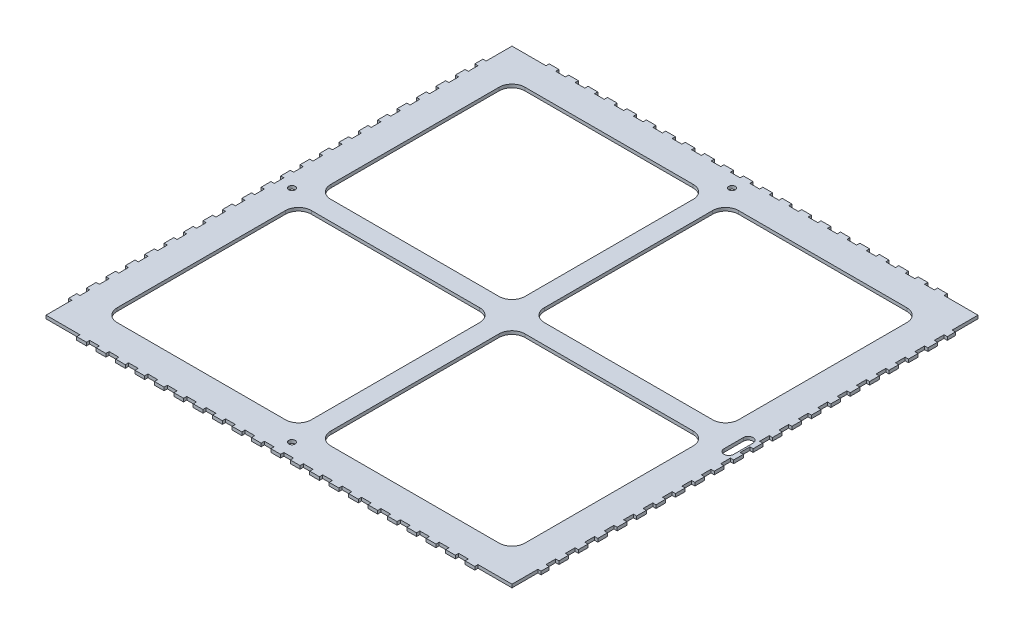
from build123d import *

# Parameters (mm, degrees)
SKETCH1_W                = 228.6
SKETCH1_H                = 228.6
BOSS_EXTRUDE1_DEPTH      = 0.79375
SKETCH2_W                = 4.7625
SKETCH2_H                = 1.5875
BOSS_EXTRUDE2_DEPTH      = 1.5875
LPATTERN1_COUNT          = 11
LPATTERN1_PITCH          = 9.525
LPATTERN1_COL_COUNT      = 11
LPATTERN1_COL_PITCH      = 9.525
MIRROR1_COPY_1_SKETCH_W  = 4.7625
MIRROR1_COPY_1_SKETCH_H  = 1.5875
MIRROR1_COPY_1_DEPTH     = 1.5875
MIRROR1_COPY_2_SKETCH_W  = 4.7625
MIRROR1_COPY_2_SKETCH_H  = 1.5875
MIRROR1_COPY_2_DEPTH     = 1.5875
MIRROR1_COPY_3_SKETCH_W  = 4.7625
MIRROR1_COPY_3_SKETCH_H  = 1.5875
MIRROR1_COPY_3_DEPTH     = 1.5875
MIRROR1_COPY_4_SKETCH_W  = 4.7625
MIRROR1_COPY_4_SKETCH_H  = 1.5875
MIRROR1_COPY_4_DEPTH     = 1.5875
MIRROR1_COPY_5_SKETCH_W  = 4.7625
MIRROR1_COPY_5_SKETCH_H  = 1.5875
MIRROR1_COPY_5_DEPTH     = 1.5875
MIRROR1_COPY_6_SKETCH_W  = 4.7625
MIRROR1_COPY_6_SKETCH_H  = 1.5875
MIRROR1_COPY_6_DEPTH     = 1.5875
MIRROR1_COPY_7_SKETCH_W  = 4.7625
MIRROR1_COPY_7_SKETCH_H  = 1.5875
MIRROR1_COPY_7_DEPTH     = 1.5875
MIRROR1_COPY_8_SKETCH_W  = 4.7625
MIRROR1_COPY_8_SKETCH_H  = 1.5875
MIRROR1_COPY_8_DEPTH     = 1.5875
MIRROR1_COPY_9_SKETCH_W  = 4.7625
MIRROR1_COPY_9_SKETCH_H  = 1.5875
MIRROR1_COPY_9_DEPTH     = 1.5875
MIRROR1_COPY_10_SKETCH_W = 4.7625
MIRROR1_COPY_10_SKETCH_H = 1.5875
MIRROR1_COPY_10_DEPTH    = 1.5875
MIRROR1_COPY_11_SKETCH_W = 4.7625
MIRROR1_COPY_11_SKETCH_H = 1.5875
MIRROR1_COPY_11_DEPTH    = 1.5875
MIRROR1_COPY_12_SKETCH_W = 4.7625
MIRROR1_COPY_12_SKETCH_H = 1.5875
MIRROR1_COPY_12_DEPTH    = 1.5875
MIRROR1_COPY_13_SKETCH_W = 4.7625
MIRROR1_COPY_13_SKETCH_H = 1.5875
MIRROR1_COPY_13_DEPTH    = 1.5875
MIRROR1_COPY_14_SKETCH_W = 4.7625
MIRROR1_COPY_14_SKETCH_H = 1.5875
MIRROR1_COPY_14_DEPTH    = 1.5875
MIRROR1_COPY_15_SKETCH_W = 4.7625
MIRROR1_COPY_15_SKETCH_H = 1.5875
MIRROR1_COPY_15_DEPTH    = 1.5875
MIRROR1_COPY_16_SKETCH_W = 4.7625
MIRROR1_COPY_16_SKETCH_H = 1.5875
MIRROR1_COPY_16_DEPTH    = 1.5875
MIRROR1_COPY_17_SKETCH_W = 4.7625
MIRROR1_COPY_17_SKETCH_H = 1.5875
MIRROR1_COPY_17_DEPTH    = 1.5875
MIRROR1_COPY_18_SKETCH_W = 4.7625
MIRROR1_COPY_18_SKETCH_H = 1.5875
MIRROR1_COPY_18_DEPTH    = 1.5875
MIRROR1_COPY_19_SKETCH_W = 4.7625
MIRROR1_COPY_19_SKETCH_H = 1.5875
MIRROR1_COPY_19_DEPTH    = 1.5875
MIRROR1_COPY_20_SKETCH_W = 4.7625
MIRROR1_COPY_20_SKETCH_H = 1.5875
MIRROR1_COPY_20_DEPTH    = 1.5875
SKETCH3_W                = 1.5875
SKETCH3_H                = 4.7625
BOSS_EXTRUDE3_DEPTH      = 1.5875
LPATTERN2_COUNT          = 6
LPATTERN2_PITCH          = 19.05
LPATTERN2_COL_COUNT      = 6
LPATTERN2_COL_PITCH      = 19.05
SKETCH5_W                = 1.5875
SKETCH5_H                = 0.79375
CUT_EXTRUDE1_DEPTH       = 164.897362605
MIRROR2_START            = 114.3
MIRROR2_OUTLINE_W        = 1.5875
MIRROR2_OUTLINE_H        = 4.7625
MIRROR2_OUTLINE_H_2      = 3.96875
MIRROR2_DEPTH            = 1.5875
SKETCH6_R                = 1.5875
CUT_EXTRUDE2_DEPTH       = 164.897362605
CUT_EXTRUDE3_DEPTH       = 164.897362605
SKETCH8_W                = 95.25
SKETCH8_H                = 95.25
CUT_EXTRUDE4_DEPTH       = 164.897362605
FILLET1_R                = 6.35


# Read off the part's stored shape, not the designer's step: Mirror2
with BuildPart() as part:
    # Sketch1 → Boss-Extrude1 (new, symmetric)
    with BuildSketch(Plane(origin=(0, 0, 0), x_dir=(1, 0, 0), z_dir=(0, 1, 0))):
        Rectangle(SKETCH1_W, SKETCH1_H)
    extrude(amount=BOSS_EXTRUDE1_DEPTH, both=True)

    # Sketch2 → Boss-Extrude2 (add)
    with BuildSketch(Plane(origin=(0, 0.79375, 0), x_dir=(1, 0, 0), z_dir=(0, 1, 0))):
        with Locations((0, 115.09375)):
            Rectangle(SKETCH2_W, SKETCH2_H)
    boss_extrude2 = extrude(amount=-BOSS_EXTRUDE2_DEPTH)

    # LPattern1: Boss-Extrude2 ×11
    with Locations(*[(i * LPATTERN1_PITCH, 0, 0) for i in range(1, LPATTERN1_COUNT)]):
        add(boss_extrude2)

    # LPattern1 col: Boss-Extrude2 ×11
    with Locations(*[(-i * LPATTERN1_COL_PITCH, 0, 0) for i in range(1, LPATTERN1_COL_COUNT)]):
        add(boss_extrude2)

    # Mirror1: Boss-Extrude2 across plane
    add(boss_extrude2.mirror(Plane.XY))

    # Mirror1 copy 1 sketch → Mirror1 copy 1 (add)
    with BuildSketch(Plane(origin=(9.525, 0.79375, 0), x_dir=(1, 0, 0), z_dir=(0, 1, 0))):
        with Locations((0, -115.09375)):
            Rectangle(MIRROR1_COPY_1_SKETCH_W, MIRROR1_COPY_1_SKETCH_H)
    extrude(amount=-MIRROR1_COPY_1_DEPTH)

    # Mirror1 copy 2 sketch → Mirror1 copy 2 (add)
    with BuildSketch(Plane(origin=(19.05, 0.79375, 0), x_dir=(1, 0, 0), z_dir=(0, 1, 0))):
        with Locations((0, -115.09375)):
            Rectangle(MIRROR1_COPY_2_SKETCH_W, MIRROR1_COPY_2_SKETCH_H)
    extrude(amount=-MIRROR1_COPY_2_DEPTH)

    # Mirror1 copy 3 sketch → Mirror1 copy 3 (add)
    with BuildSketch(Plane(origin=(28.575, 0.79375, 0), x_dir=(1, 0, 0), z_dir=(0, 1, 0))):
        with Locations((0, -115.09375)):
            Rectangle(MIRROR1_COPY_3_SKETCH_W, MIRROR1_COPY_3_SKETCH_H)
    extrude(amount=-MIRROR1_COPY_3_DEPTH)

    # Mirror1 copy 4 sketch → Mirror1 copy 4 (add)
    with BuildSketch(Plane(origin=(38.1, 0.79375, 0), x_dir=(1, 0, 0), z_dir=(0, 1, 0))):
        with Locations((0, -115.09375)):
            Rectangle(MIRROR1_COPY_4_SKETCH_W, MIRROR1_COPY_4_SKETCH_H)
    extrude(amount=-MIRROR1_COPY_4_DEPTH)

    # Mirror1 copy 5 sketch → Mirror1 copy 5 (add)
    with BuildSketch(Plane(origin=(47.625, 0.79375, 0), x_dir=(1, 0, 0), z_dir=(0, 1, 0))):
        with Locations((0, -115.09375)):
            Rectangle(MIRROR1_COPY_5_SKETCH_W, MIRROR1_COPY_5_SKETCH_H)
    extrude(amount=-MIRROR1_COPY_5_DEPTH)

    # Mirror1 copy 6 sketch → Mirror1 copy 6 (add)
    with BuildSketch(Plane(origin=(57.15, 0.79375, 0), x_dir=(1, 0, 0), z_dir=(0, 1, 0))):
        with Locations((0, -115.09375)):
            Rectangle(MIRROR1_COPY_6_SKETCH_W, MIRROR1_COPY_6_SKETCH_H)
    extrude(amount=-MIRROR1_COPY_6_DEPTH)

    # Mirror1 copy 7 sketch → Mirror1 copy 7 (add)
    with BuildSketch(Plane(origin=(66.675, 0.79375, 0), x_dir=(1, 0, 0), z_dir=(0, 1, 0))):
        with Locations((0, -115.09375)):
            Rectangle(MIRROR1_COPY_7_SKETCH_W, MIRROR1_COPY_7_SKETCH_H)
    extrude(amount=-MIRROR1_COPY_7_DEPTH)

    # Mirror1 copy 8 sketch → Mirror1 copy 8 (add)
    with BuildSketch(Plane(origin=(76.2, 0.79375, 0), x_dir=(1, 0, 0), z_dir=(0, 1, 0))):
        with Locations((0, -115.09375)):
            Rectangle(MIRROR1_COPY_8_SKETCH_W, MIRROR1_COPY_8_SKETCH_H)
    extrude(amount=-MIRROR1_COPY_8_DEPTH)

    # Mirror1 copy 9 sketch → Mirror1 copy 9 (add)
    with BuildSketch(Plane(origin=(85.725, 0.79375, 0), x_dir=(1, 0, 0), z_dir=(0, 1, 0))):
        with Locations((0, -115.09375)):
            Rectangle(MIRROR1_COPY_9_SKETCH_W, MIRROR1_COPY_9_SKETCH_H)
    extrude(amount=-MIRROR1_COPY_9_DEPTH)

    # Mirror1 copy 10 sketch → Mirror1 copy 10 (add)
    with BuildSketch(Plane(origin=(95.25, 0.79375, 0), x_dir=(1, 0, 0), z_dir=(0, 1, 0))):
        with Locations((0, -115.09375)):
            Rectangle(MIRROR1_COPY_10_SKETCH_W, MIRROR1_COPY_10_SKETCH_H)
    extrude(amount=-MIRROR1_COPY_10_DEPTH)

    # Mirror1 copy 11 sketch → Mirror1 copy 11 (add)
    with BuildSketch(Plane(origin=(-9.525, 0.79375, 0), x_dir=(1, 0, 0), z_dir=(0, 1, 0))):
        with Locations((0, -115.09375)):
            Rectangle(MIRROR1_COPY_11_SKETCH_W, MIRROR1_COPY_11_SKETCH_H)
    extrude(amount=-MIRROR1_COPY_11_DEPTH)

    # Mirror1 copy 12 sketch → Mirror1 copy 12 (add)
    with BuildSketch(Plane(origin=(-19.05, 0.79375, 0), x_dir=(1, 0, 0), z_dir=(0, 1, 0))):
        with Locations((0, -115.09375)):
            Rectangle(MIRROR1_COPY_12_SKETCH_W, MIRROR1_COPY_12_SKETCH_H)
    extrude(amount=-MIRROR1_COPY_12_DEPTH)

    # Mirror1 copy 13 sketch → Mirror1 copy 13 (add)
    with BuildSketch(Plane(origin=(-28.575, 0.79375, 0), x_dir=(1, 0, 0), z_dir=(0, 1, 0))):
        with Locations((0, -115.09375)):
            Rectangle(MIRROR1_COPY_13_SKETCH_W, MIRROR1_COPY_13_SKETCH_H)
    extrude(amount=-MIRROR1_COPY_13_DEPTH)

    # Mirror1 copy 14 sketch → Mirror1 copy 14 (add)
    with BuildSketch(Plane(origin=(-38.1, 0.79375, 0), x_dir=(1, 0, 0), z_dir=(0, 1, 0))):
        with Locations((0, -115.09375)):
            Rectangle(MIRROR1_COPY_14_SKETCH_W, MIRROR1_COPY_14_SKETCH_H)
    extrude(amount=-MIRROR1_COPY_14_DEPTH)

    # Mirror1 copy 15 sketch → Mirror1 copy 15 (add)
    with BuildSketch(Plane(origin=(-47.625, 0.79375, 0), x_dir=(1, 0, 0), z_dir=(0, 1, 0))):
        with Locations((0, -115.09375)):
            Rectangle(MIRROR1_COPY_15_SKETCH_W, MIRROR1_COPY_15_SKETCH_H)
    extrude(amount=-MIRROR1_COPY_15_DEPTH)

    # Mirror1 copy 16 sketch → Mirror1 copy 16 (add)
    with BuildSketch(Plane(origin=(-57.15, 0.79375, 0), x_dir=(1, 0, 0), z_dir=(0, 1, 0))):
        with Locations((0, -115.09375)):
            Rectangle(MIRROR1_COPY_16_SKETCH_W, MIRROR1_COPY_16_SKETCH_H)
    extrude(amount=-MIRROR1_COPY_16_DEPTH)

    # Mirror1 copy 17 sketch → Mirror1 copy 17 (add)
    with BuildSketch(Plane(origin=(-66.675, 0.79375, 0), x_dir=(1, 0, 0), z_dir=(0, 1, 0))):
        with Locations((0, -115.09375)):
            Rectangle(MIRROR1_COPY_17_SKETCH_W, MIRROR1_COPY_17_SKETCH_H)
    extrude(amount=-MIRROR1_COPY_17_DEPTH)

    # Mirror1 copy 18 sketch → Mirror1 copy 18 (add)
    with BuildSketch(Plane(origin=(-76.2, 0.79375, 0), x_dir=(1, 0, 0), z_dir=(0, 1, 0))):
        with Locations((0, -115.09375)):
            Rectangle(MIRROR1_COPY_18_SKETCH_W, MIRROR1_COPY_18_SKETCH_H)
    extrude(amount=-MIRROR1_COPY_18_DEPTH)

    # Mirror1 copy 19 sketch → Mirror1 copy 19 (add)
    with BuildSketch(Plane(origin=(-85.725, 0.79375, 0), x_dir=(1, 0, 0), z_dir=(0, 1, 0))):
        with Locations((0, -115.09375)):
            Rectangle(MIRROR1_COPY_19_SKETCH_W, MIRROR1_COPY_19_SKETCH_H)
    extrude(amount=-MIRROR1_COPY_19_DEPTH)

    # Mirror1 copy 20 sketch → Mirror1 copy 20 (add)
    with BuildSketch(Plane(origin=(-95.25, 0.79375, 0), x_dir=(1, 0, 0), z_dir=(0, 1, 0))):
        with Locations((0, -115.09375)):
            Rectangle(MIRROR1_COPY_20_SKETCH_W, MIRROR1_COPY_20_SKETCH_H)
    extrude(amount=-MIRROR1_COPY_20_DEPTH)

    # Sketch3 → Boss-Extrude3 (add)
    with BuildSketch(Plane(origin=(0, 0.79375, 0), x_dir=(1, 0, 0), z_dir=(0, 1, 0))):
        with Locations((-115.09375, 4.7625)):
            Rectangle(SKETCH3_W, SKETCH3_H)
        with Locations((-115.09375, -4.7625)):
            Rectangle(SKETCH3_W, SKETCH3_H)
    boss_extrude3 = extrude(amount=-BOSS_EXTRUDE3_DEPTH)

    # LPattern2: Boss-Extrude3 ×6
    with Locations(*[(0, 0, -i * LPATTERN2_PITCH) for i in range(1, LPATTERN2_COUNT)]):
        add(boss_extrude3)

    # LPattern2 col: Boss-Extrude3 ×6
    with Locations(*[(0, 0, i * LPATTERN2_COL_PITCH) for i in range(1, LPATTERN2_COL_COUNT)]):
        add(boss_extrude3)

    # Sketch5 → Cut-Extrude1 (cut, through all)
    with BuildSketch(Plane(origin=(0, 0.79375, 0), x_dir=(1, 0, 0), z_dir=(0, 1, 0))):
        with Locations((-115.09375, -101.996875)):
            Rectangle(SKETCH5_W, SKETCH5_H)
        with Locations((-115.09375, 101.996875)):
            Rectangle(SKETCH5_W, SKETCH5_H)
    extrude(amount=-CUT_EXTRUDE1_DEPTH, mode=Mode.SUBTRACT)

    # Mirror2 outline → Mirror2 (add)
    with BuildSketch(Plane.YZ.offset(MIRROR2_START)):
        with Locations((0, 4.7625)):
            Rectangle(MIRROR2_OUTLINE_W, MIRROR2_OUTLINE_H)
        with Locations((0, 14.2875)):
            Rectangle(MIRROR2_OUTLINE_W, MIRROR2_OUTLINE_H)
        with Locations((0, -4.7625)):
            Rectangle(MIRROR2_OUTLINE_W, MIRROR2_OUTLINE_H)
        with Locations((0, 23.8125)):
            Rectangle(MIRROR2_OUTLINE_W, MIRROR2_OUTLINE_H)
        with Locations((0, -14.2875)):
            Rectangle(MIRROR2_OUTLINE_W, MIRROR2_OUTLINE_H)
        with Locations((0, 33.3375)):
            Rectangle(MIRROR2_OUTLINE_W, MIRROR2_OUTLINE_H)
        with Locations((0, -23.8125)):
            Rectangle(MIRROR2_OUTLINE_W, MIRROR2_OUTLINE_H)
        with Locations((0, 42.8625)):
            Rectangle(MIRROR2_OUTLINE_W, MIRROR2_OUTLINE_H)
        with Locations((0, -33.3375)):
            Rectangle(MIRROR2_OUTLINE_W, MIRROR2_OUTLINE_H)
        with Locations((0, 52.3875)):
            Rectangle(MIRROR2_OUTLINE_W, MIRROR2_OUTLINE_H)
        with Locations((0, -42.8625)):
            Rectangle(MIRROR2_OUTLINE_W, MIRROR2_OUTLINE_H)
        with Locations((0, 61.9125)):
            Rectangle(MIRROR2_OUTLINE_W, MIRROR2_OUTLINE_H)
        with Locations((0, -52.3875)):
            Rectangle(MIRROR2_OUTLINE_W, MIRROR2_OUTLINE_H)
        with Locations((0, 71.4375)):
            Rectangle(MIRROR2_OUTLINE_W, MIRROR2_OUTLINE_H)
        with Locations((0, -61.9125)):
            Rectangle(MIRROR2_OUTLINE_W, MIRROR2_OUTLINE_H)
        with Locations((0, 80.9625)):
            Rectangle(MIRROR2_OUTLINE_W, MIRROR2_OUTLINE_H)
        with Locations((0, -71.4375)):
            Rectangle(MIRROR2_OUTLINE_W, MIRROR2_OUTLINE_H)
        with Locations((0, 90.4875)):
            Rectangle(MIRROR2_OUTLINE_W, MIRROR2_OUTLINE_H)
        with Locations((0, -80.9625)):
            Rectangle(MIRROR2_OUTLINE_W, MIRROR2_OUTLINE_H)
        with Locations((0, 99.615625)):
            Rectangle(MIRROR2_OUTLINE_W, MIRROR2_OUTLINE_H_2)
        with Locations((0, -90.4875)):
            Rectangle(MIRROR2_OUTLINE_W, MIRROR2_OUTLINE_H)
        with Locations((0, -99.615625)):
            Rectangle(MIRROR2_OUTLINE_W, MIRROR2_OUTLINE_H_2)
    extrude(amount=MIRROR2_DEPTH)

    # Sketch6 → Cut-Extrude2 (cut, through all)
    with BuildSketch(Plane(origin=(0, 0.79375, 0), x_dir=(1, 0, 0), z_dir=(0, 1, 0))):
        with Locations(Location((-107.95, 0, 0), (0, 0, 270))):
            Circle(SKETCH6_R)
        with Locations(Location((0, 107.95, 0), (0, 0, 270))):
            Circle(SKETCH6_R)
        with Locations(Location((0, -107.95, 0), (0, 0, 270))):
            Circle(SKETCH6_R)
    extrude(amount=-CUT_EXTRUDE2_DEPTH, mode=Mode.SUBTRACT)

    # Sketch7 → Cut-Extrude3 (cut, through all)
    with BuildSketch(Plane(origin=(0, 0.79375, 0), x_dir=(1, 0, 0), z_dir=(0, 1, 0))):
        with BuildLine():
            Line((113.50625, 4.7625), (113.50625, -4.7625))
            ThreePointArc((113.50625, -4.7625), (111.125, -7.14375), (108.74375, -4.7625))
            Line((108.74375, -4.7625), (108.74375, 4.7625))
            ThreePointArc((108.74375, 4.7625), (111.125, 7.14375), (113.50625, 4.7625))
        make_face()
    extrude(amount=-CUT_EXTRUDE3_DEPTH, mode=Mode.SUBTRACT)

    # Sketch8 → Cut-Extrude4 (cut, through all)
    with BuildSketch(Plane(origin=(0, 0.79375, 0), x_dir=(1, 0, 0), z_dir=(0, 1, 0))):
        with Locations((-52.3875, 52.3875)):
            Rectangle(SKETCH8_W, SKETCH8_H)
        with Locations((-52.3875, -52.3875)):
            Rectangle(SKETCH8_W, SKETCH8_H)
        with Locations((52.3875, -52.3875)):
            Rectangle(SKETCH8_W, SKETCH8_H)
        with Locations((52.3875, 52.3875)):
            Rectangle(SKETCH8_W, SKETCH8_H)
    extrude(amount=-CUT_EXTRUDE4_DEPTH, mode=Mode.SUBTRACT)

    # Fillet1
    fillet1_edges = [part.edges().sort_by_distance(p)[0] for p in [
        (-4.7625, 0, -100.0125),
        (-4.7625, 0, -4.7625),
        (-100.0125, 0, -4.7625),
        (-100.0125, 0, -100.0125),
        (-4.7625, 0, 4.7625),
        (-4.7625, 0, 100.0125),
        (-100.0125, 0, 100.0125),
        (-100.0125, 0, 4.7625),
        (100.0125, 0, 4.7625),
        (100.0125, 0, 100.0125),
        (4.7625, 0, 100.0125),
        (4.7625, 0, 4.7625),
        (100.0125, 0, -100.0125),
        (100.0125, 0, -4.7625),
        (4.7625, 0, -4.7625),
        (4.7625, 0, -100.0125),
    ]]
    fillet(fillet1_edges, radius=FILLET1_R)


solid = part.part
